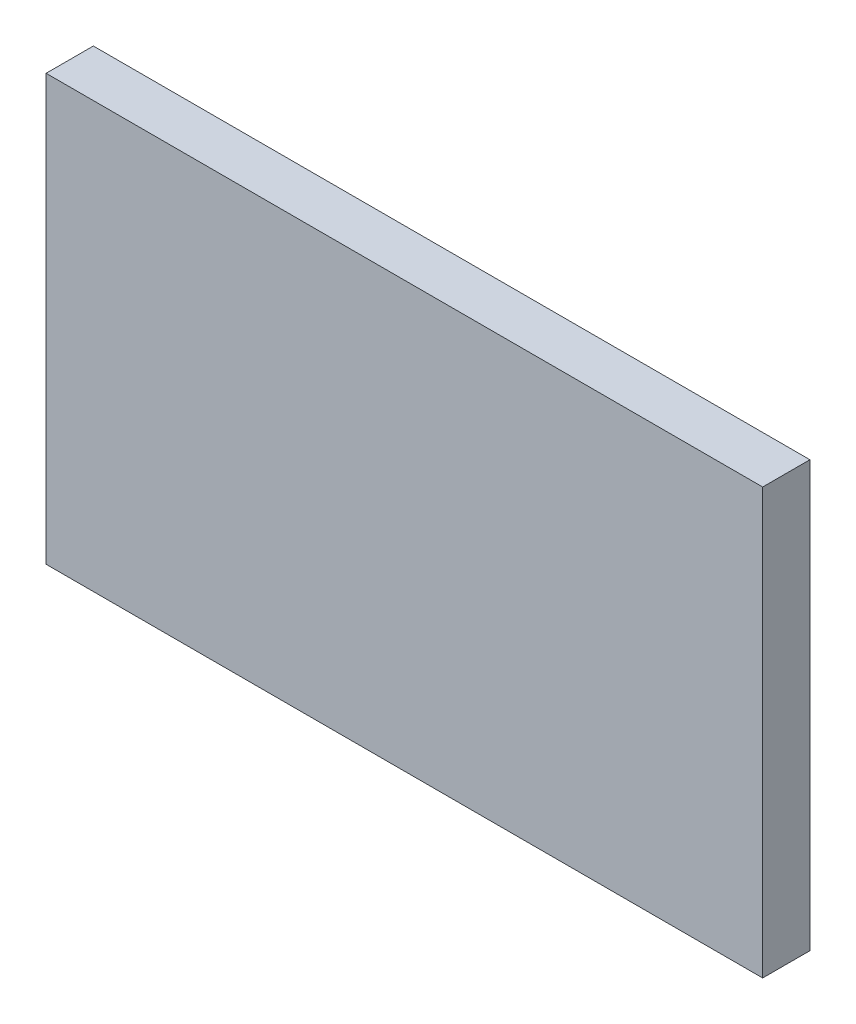
from build123d import *

# Parameters (mm, degrees)
SKETCH1_W           = 45.5
SKETCH1_H           = 27
BOSS_EXTRUDE1_DEPTH = 3


with BuildPart() as part:
    # Sketch1 → Boss-Extrude1 (new body)
    with BuildSketch(Plane.XY):
        with Locations((22.75, 13.5)):
            Rectangle(SKETCH1_W, SKETCH1_H)
    extrude(amount=BOSS_EXTRUDE1_DEPTH)


solid = part.part
